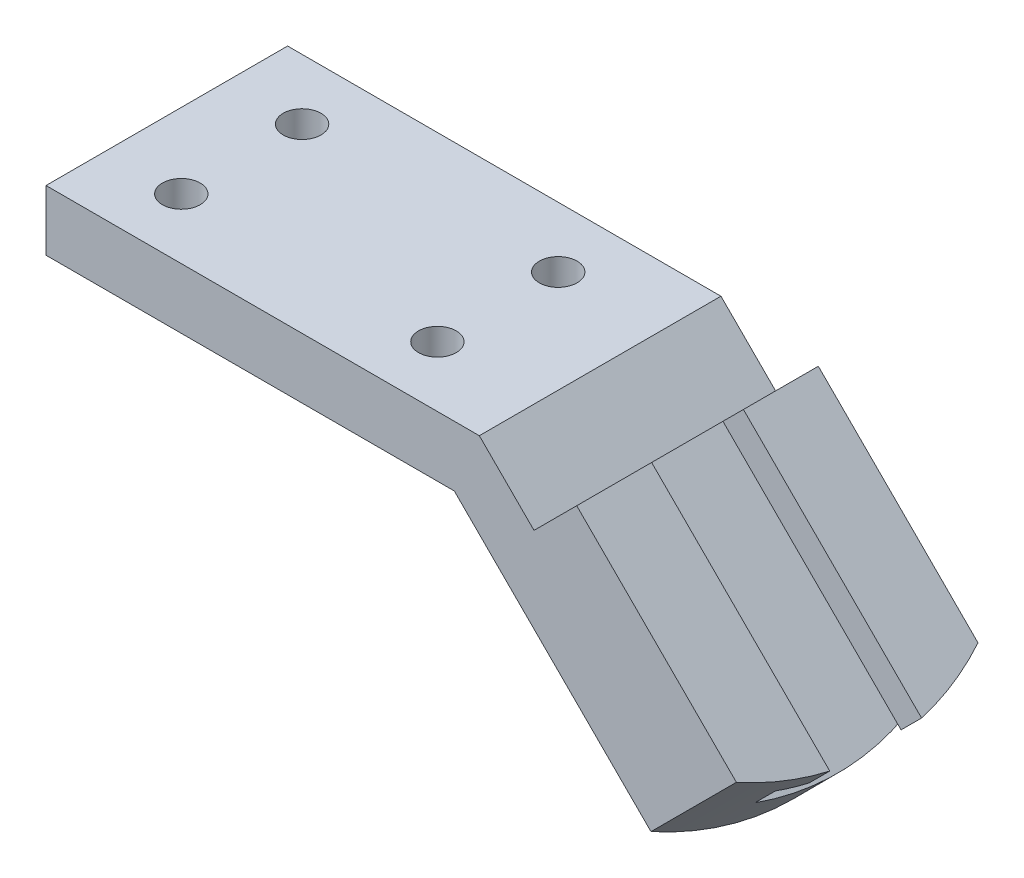
from build123d import *

# Parameters (mm, degrees)
BOSS_EXTRUDE1_DEPTH = 25.4
CUT_EXTRUDE2_DEPTH  = 12.192
CUT_EXTRUDE3_DEPTH  = 141.749443769
SKETCH3_W           = 31.496
SKETCH3_H           = 6.096
CUT_EXTRUDE4_DEPTH  = 120.736402781
SKETCH4_R           = 3.96875
CUT_EXTRUDE5_DEPTH  = 163.137144219


with BuildPart() as part:
    # Sketch1 → Boss-Extrude1 (new, symmetric)
    with BuildSketch(Plane.XY):
        Polygon((0, 0), (85.852, 0), (131.703269909, -45.851269909), (149.663782152, -27.890757667), (111.587496198, 10.185528286), (102.607240077, 1.205272165), (91.112512242, 12.7), (0, 12.7), align=None)
    extrude(amount=BOSS_EXTRUDE1_DEPTH, both=True)

    # Sketch2 → Cut-Extrude2 (cut)
    with BuildSketch(Plane(origin=(60.886512242, 60.886512242, 0), x_dir=(0, 0, -1), z_dir=(0.707106781186544, 0.7071067811865511, 0))):
        with BuildLine():
            Line((-25.4, -119.183037491), (-25.4, -125.550019136))
            Line((-25.4, -125.550019136), (25.4, -125.550019136))
            Line((25.4, -125.550019136), (25.4, -119.183037491))
            ThreePointArc((25.4, -119.183037491), (17.740042491, -122.543911277), (9.652, -124.677919317))
            Line((9.652, -124.677919317), (9.652, -71.702019136))
            Line((9.652, -71.702019136), (-9.652, -71.702019136))
            Line((-9.652, -71.702019136), (-9.652, -124.677919317))
            ThreePointArc((-9.652, -124.677919317), (-17.740042491, -122.543911277), (-25.4, -119.183037491))
        make_face()
    extrude(amount=-CUT_EXTRUDE2_DEPTH, mode=Mode.SUBTRACT)

    # Sketch2<5> → Cut-Extrude3 (cut, through all)
    with BuildSketch(Plane(origin=(60.886512242, 60.886512242, 0), x_dir=(0, 0, -1), z_dir=(0.707106781186544, 0.7071067811865511, 0))):
        with BuildLine():
            Line((-25.4, -119.183037491), (-25.4, -125.550019136))
            Line((-25.4, -125.550019136), (0, -125.550019136))
            ThreePointArc((0, -125.550019136), (-13.09292228, -123.934025513), (-25.4, -119.183037491))
        make_face()
        with BuildLine():
            Line((0, -125.550019136), (25.4, -125.550019136))
            Line((25.4, -125.550019136), (25.4, -119.183037491))
            ThreePointArc((25.4, -119.183037491), (13.09292228, -123.934025513), (0, -125.550019136))
        make_face()
    extrude(amount=-CUT_EXTRUDE3_DEPTH, mode=Mode.SUBTRACT)

    # Sketch3 → Cut-Extrude4 (cut, through all)
    with BuildSketch(Plane(origin=(50.700983956, -50.700983956, 0), x_dir=(0, 0, 1), z_dir=(-0.7071067811865549, 0.7071067811865401, 0))):
        with Locations((0, 76.962531378)):
            Rectangle(SKETCH3_W, SKETCH3_H)
    extrude(amount=-CUT_EXTRUDE4_DEPTH, mode=Mode.SUBTRACT)

    # Sketch4 → Cut-Extrude5 (cut, through all)
    with BuildSketch(Plane(origin=(0, 12.7, 0), x_dir=(1, 0, 0), z_dir=(0, 1, 0))):
        with Locations((15.748, 12.7)):
            Circle(SKETCH4_R)
        with Locations((69.596, 12.7)):
            Circle(SKETCH4_R)
        with Locations((15.748, -12.7)):
            Circle(SKETCH4_R)
        with Locations((69.596, -12.7)):
            Circle(SKETCH4_R)
    extrude(amount=-CUT_EXTRUDE5_DEPTH, mode=Mode.SUBTRACT)


solid = part.part
